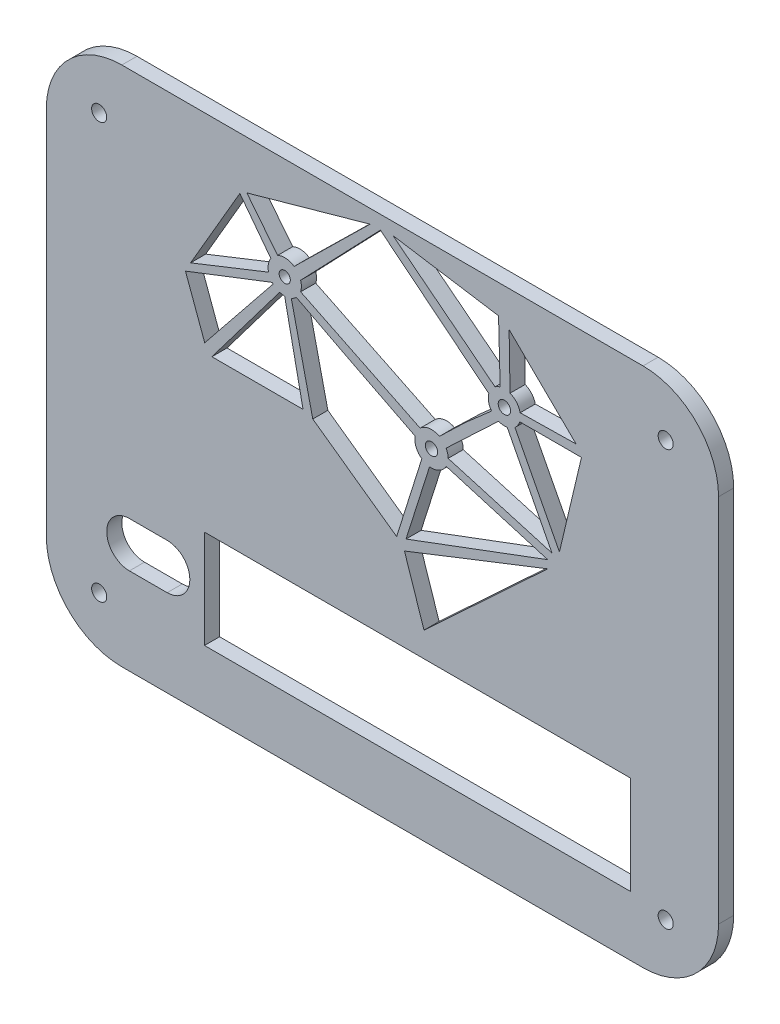
from build123d import *

# Parameters (mm, degrees)
SKETCH_1_R          = 1
EXTRUDE_1_DEPTH     = 2
CUT_EXTRUDE_1_REACH = 114.632
CUT_EXTRUDE_2_REACH = 114.632
SKETCH_3_W          = 56.426209876
SKETCH_3_H          = 13
CUT_EXTRUDE_3_REACH = 114.632
SKETCH_4_R          = 0.740461
SKETCH_4_R_2        = 0.820057981
SKETCH_4_R_3        = 0.813320815


with BuildPart() as part:
    # 草图1 → 凸台-拉伸1 (new body)
    with BuildSketch(Plane.XY):
        with BuildLine():
            ThreePointArc((10, 0), (2.928932188, -2.928932188), (0, -10))
            Line((0, -10), (0, -59))
            ThreePointArc((0, -59), (2.928932188, -66.071067812), (10, -69))
            Line((10, -69), (79, -69))
            ThreePointArc((79, -69), (86.071067812, -66.071067812), (89, -59))
            Line((89, -59), (89, -10))
            ThreePointArc((89, -10), (86.071067812, -2.928932188), (79, 0))
            Line((79, 0), (10, 0))
        make_face()
        with Locations((7, -7)):
            Circle(SKETCH_1_R, mode=Mode.SUBTRACT)
        with Locations((82, -7)):
            Circle(SKETCH_1_R, mode=Mode.SUBTRACT)
        with Locations((7, -62)):
            Circle(SKETCH_1_R, mode=Mode.SUBTRACT)
        with Locations((82, -62)):
            Circle(SKETCH_1_R, mode=Mode.SUBTRACT)
    extrude(amount=-EXTRUDE_1_DEPTH)

    # 草图2 → 切除-拉伸1 (cut, up to next)
    with BuildSketch(Plane.XY, mode=Mode.PRIVATE) as cut_extrude_1_sk1:
        with BuildLine():
            Line((11, -51.5), (16, -51.5))
            ThreePointArc((16, -51.5), (19, -54.5), (16, -57.5))
            Line((16, -57.5), (11, -57.5))
            ThreePointArc((11, -57.5), (8, -54.5), (11, -51.5))
        make_face()
    cut_extrude_1_tool1 = extrude(cut_extrude_1_sk1.sketch, amount=-CUT_EXTRUDE_1_REACH, mode=Mode.PRIVATE) & part.part
    add(cut_extrude_1_tool1.solids().sort_by_distance((13.5, -54.5, 0))[0], mode=Mode.SUBTRACT)

    # 草图3 → 切除-拉伸2 (cut, up to next)
    with BuildSketch(Plane.XY, mode=Mode.PRIVATE) as cut_extrude_2_sk1:
        with Locations((49.151392617, -54.584348468)):
            Rectangle(SKETCH_3_W, SKETCH_3_H)
    cut_extrude_2_tool1 = extrude(cut_extrude_2_sk1.sketch, amount=-CUT_EXTRUDE_2_REACH, mode=Mode.PRIVATE) & part.part
    add(cut_extrude_2_tool1.solids().sort_by_distance((49.151393, -54.584348, 0))[0], mode=Mode.SUBTRACT)

    # 草图4 → 切除-拉伸3 (cut, up to next)
    with BuildSketch(Plane.XY, mode=Mode.PRIVATE) as cut_extrude_3_sk1:
        with BuildLine():
            Line((29.71966231, -12.305090175), (25.624356849, -6.911105654))
            Line((25.624356849, -6.911105654), (19.101020316, -18.131976546))
            Line((19.101020316, -18.131976546), (29.427775095, -14.04090443))
            ThreePointArc((29.427775095, -14.04090443), (29.392941994, -13.142598653), (29.71966231, -12.305090175))
        make_face()
    cut_extrude_3_tool1 = extrude(cut_extrude_3_sk1.sketch, amount=-CUT_EXTRUDE_3_REACH, mode=Mode.PRIVATE) & part.part
    # 草图4 → 切除-拉伸3 (cut, up to next)
    with BuildSketch(Plane.XY, mode=Mode.PRIVATE) as cut_extrude_3_sk2:
        with BuildLine():
            Line((26.551833571, -6.38746953), (30.617859486, -11.518503533))
            ThreePointArc((30.617859486, -11.518503533), (31.736947981, -11.310402053), (32.810649266, -11.688331722))
            Line((32.810649266, -11.688331722), (42.857597029, -1.819271366))
            Line((42.857597029, -1.819271366), (26.551833571, -6.38746953))
        make_face()
    cut_extrude_3_tool2 = extrude(cut_extrude_3_sk2.sketch, amount=-CUT_EXTRUDE_3_REACH, mode=Mode.PRIVATE) & part.part
    # 草图4 → 切除-拉伸3 (cut, up to next)
    with BuildSketch(Plane.XY, mode=Mode.PRIVATE) as cut_extrude_3_sk3:
        with BuildLine():
            ThreePointArc((30.032334908, -15.090731341), (29.972405764, -15.030340271), (29.914851736, -14.967681531))
            Line((29.914851736, -14.967681531), (18.421083699, -19.418282761))
            Line((18.421083699, -19.418282761), (20.971275942, -26.365204728))
            Line((20.971275942, -26.365204728), (30.032334908, -15.090731341))
        make_face()
    cut_extrude_3_tool3 = extrude(cut_extrude_3_sk3.sketch, amount=-CUT_EXTRUDE_3_REACH, mode=Mode.PRIVATE) & part.part
    # 草图4 → 切除-拉伸3 (cut, up to next)
    with BuildSketch(Plane.XY, mode=Mode.PRIVATE) as cut_extrude_3_sk4:
        with BuildLine():
            Line((44.225353899, -1.819271366), (33.668211048, -12.842696697))
            ThreePointArc((33.668211048, -12.842696697), (33.771051205, -13.50813486), (33.668211048, -14.173573023))
            Line((33.668211048, -14.173573023), (49.492109237, -21.888754028))
            ThreePointArc((49.492109237, -21.888754028), (50.711573343, -21.316782641), (52.036115922, -21.561386254))
            Line((52.036115922, -21.561386254), (55.490802813, -18.236876623))
            Line((55.490802813, -18.236876623), (58.941354458, -15.204854904))
            ThreePointArc((58.941354458, -15.204854904), (58.555360551, -14.33538652), (58.58699022, -13.384615186))
            Line((58.58699022, -13.384615186), (44.225353899, -1.819271366))
        make_face()
    cut_extrude_3_tool4 = extrude(cut_extrude_3_sk4.sketch, amount=-CUT_EXTRUDE_3_REACH, mode=Mode.PRIVATE) & part.part
    # 草图4 → 切除-拉伸3 (cut, up to next)
    with BuildSketch(Plane.XY, mode=Mode.PRIVATE) as cut_extrude_3_sk5:
        with BuildLine():
            ThreePointArc((31.554094643, -15.712412849), (31.220078502, -15.685020065), (30.894075467, -15.607307982))
            Line((30.894075467, -15.607307982), (21.91981842, -27.487784108))
            Line((21.91981842, -27.487784108), (33.987562974, -27.487784108))
            Line((33.987562974, -27.487784108), (31.554094643, -15.712412849))
        make_face()
    cut_extrude_3_tool5 = extrude(cut_extrude_3_sk5.sketch, amount=-CUT_EXTRUDE_3_REACH, mode=Mode.PRIVATE) & part.part
    # 草图4 → 切除-拉伸3 (cut, up to next)
    with BuildSketch(Plane.XY, mode=Mode.PRIVATE) as cut_extrude_3_sk6:
        with BuildLine():
            Line((45.888987928, -1.608866352), (59.403976502, -12.200184937))
            ThreePointArc((59.403976502, -12.200184937), (59.729360819, -12.008222916), (60.083573274, -11.876853558))
            Line((60.083573274, -11.876853558), (59.870610643, -3.82441582))
            Line((59.870610643, -3.82441582), (45.888987928, -1.608866352))
        make_face()
    cut_extrude_3_tool6 = extrude(cut_extrude_3_sk6.sketch, amount=-CUT_EXTRUDE_3_REACH, mode=Mode.PRIVATE) & part.part
    # 草图4 → 切除-拉伸3 (cut, up to next)
    with BuildSketch(Plane.XY, mode=Mode.PRIVATE) as cut_extrude_3_sk7:
        with BuildLine():
            Line((39.670415507, -18.489723809), (33.101139016, -15.090731341))
            ThreePointArc((33.101139016, -15.090731341), (32.788510306, -15.342874945), (32.435320163, -15.534107344))
            Line((32.435320163, -15.534107344), (35.273577474, -27.953433219))
            Line((35.273577474, -27.953433219), (46.381058376, -35.875964466))
            Line((46.381058376, -35.875964466), (49.71272558, -25.296027344))
            ThreePointArc((49.71272558, -25.296027344), (48.953979817, -24.33842803), (48.821972428, -23.123822897))
            Line((48.821972428, -23.123822897), (39.670415507, -18.489723809))
        make_face()
    cut_extrude_3_tool7 = extrude(cut_extrude_3_sk7.sketch, amount=-CUT_EXTRUDE_3_REACH, mode=Mode.PRIVATE) & part.part
    # 草图4 → 切除-拉伸3 (cut, up to next)
    with BuildSketch(Plane.XY, mode=Mode.PRIVATE) as cut_extrude_3_sk8:
        with BuildLine():
            ThreePointArc((61.014395674, -16.023297199), (60.434752375, -16.045705576), (59.870610643, -15.91067745))
            Line((59.870610643, -15.91067745), (52.932925458, -22.457448275))
            ThreePointArc((52.932925458, -22.457448275), (53.129531926, -22.96355083), (53.196421001, -23.50236411))
            Line((53.196421001, -23.50236411), (66.944484677, -27.487784108))
            Line((66.944484677, -27.487784108), (61.014395674, -16.023297199))
        make_face()
    cut_extrude_3_tool8 = extrude(cut_extrude_3_sk8.sketch, amount=-CUT_EXTRUDE_3_REACH, mode=Mode.PRIVATE) & part.part
    # 草图4 → 切除-拉伸3 (cut, up to next)
    with BuildSketch(Plane.XY, mode=Mode.PRIVATE) as cut_extrude_3_sk9:
        with BuildLine():
            Line((61.270019501, -4.698540732), (61.390679607, -11.937596605))
            ThreePointArc((61.390679607, -11.937596605), (62.262550714, -12.549874129), (62.728146423, -13.50813486))
            Line((62.728146423, -13.50813486), (70.138763344, -13.384615186))
            Line((70.138763344, -13.384615186), (61.270019501, -4.698540732))
        make_face()
    cut_extrude_3_tool9 = extrude(cut_extrude_3_sk9.sketch, amount=-CUT_EXTRUDE_3_REACH, mode=Mode.PRIVATE) & part.part
    # 草图4 → 切除-拉伸3 (cut, up to next)
    with BuildSketch(Plane.XY, mode=Mode.PRIVATE) as cut_extrude_3_sk10:
        with BuildLine():
            ThreePointArc((62.671923931, -14.567955784), (62.422172629, -15.094839311), (62.038733508, -15.534107344))
            Line((62.038733508, -15.534107344), (67.93091315, -26.870821866))
            Line((67.93091315, -26.870821866), (70.848713756, -14.567955784))
            Line((70.848713756, -14.567955784), (62.671923931, -14.567955784))
        make_face()
    cut_extrude_3_tool10 = extrude(cut_extrude_3_sk10.sketch, amount=-CUT_EXTRUDE_3_REACH, mode=Mode.PRIVATE) & part.part
    # 草图4 → 切除-拉伸3 (cut, up to next)
    with BuildSketch(Plane.XY, mode=Mode.PRIVATE) as cut_extrude_3_sk11:
        with BuildLine():
            ThreePointArc((52.932925458, -24.547279946), (52.0105537, -25.456866509), (50.736467157, -25.691005052))
            Line((50.736467157, -25.691005052), (47.619493897, -35.541205516))
            Line((47.619493897, -35.541205516), (66.381949553, -28.52489892))
            Line((66.381949553, -28.52489892), (52.932925458, -24.547279946))
        make_face()
    cut_extrude_3_tool11 = extrude(cut_extrude_3_sk11.sketch, amount=-CUT_EXTRUDE_3_REACH, mode=Mode.PRIVATE) & part.part
    # 草图4 → 切除-拉伸3 (cut, up to next)
    with BuildSketch(Plane.XY, mode=Mode.PRIVATE) as cut_extrude_3_sk12:
        Polygon((66.381949553, -29.57390315), (47.414429955, -37.012816769), (50.002721586, -44.796327362), align=None)
    cut_extrude_3_tool12 = extrude(cut_extrude_3_sk12.sketch, amount=-CUT_EXTRUDE_3_REACH, mode=Mode.PRIVATE) & part.part
    # 草图4 → 切除-拉伸3 (cut, up to next)
    with BuildSketch(Plane.XY, mode=Mode.PRIVATE) as cut_extrude_3_sk13:
        with Locations((31.566736962, -13.50813486)):
            Circle(SKETCH_4_R)
    cut_extrude_3_tool13 = extrude(cut_extrude_3_sk13.sketch, amount=-CUT_EXTRUDE_3_REACH, mode=Mode.PRIVATE) & part.part
    # 草图4 → 切除-拉伸3 (cut, up to next)
    with BuildSketch(Plane.XY, mode=Mode.PRIVATE) as cut_extrude_3_sk14:
        with Locations((60.643174965, -13.928930845)):
            Circle(SKETCH_4_R_2)
    cut_extrude_3_tool14 = extrude(cut_extrude_3_sk14.sketch, amount=-CUT_EXTRUDE_3_REACH, mode=Mode.PRIVATE) & part.part
    # 草图4 → 切除-拉伸3 (cut, up to next)
    with BuildSketch(Plane.XY, mode=Mode.PRIVATE) as cut_extrude_3_sk15:
        with Locations((50.992818256, -23.50236411)):
            Circle(SKETCH_4_R_3)
    cut_extrude_3_tool15 = extrude(cut_extrude_3_sk15.sketch, amount=-CUT_EXTRUDE_3_REACH, mode=Mode.PRIVATE) & part.part
    add(cut_extrude_3_tool1.solids().sort_by_distance((25.011842, -12.854316, 0))[0], mode=Mode.SUBTRACT)
    add(cut_extrude_3_tool2.solids().sort_by_distance((33.74434, -6.871453, 0))[0], mode=Mode.SUBTRACT)
    add(cut_extrude_3_tool3.solids().sort_by_distance((23.203214, -20.212828, 0))[0], mode=Mode.SUBTRACT)
    add(cut_extrude_3_tool4.solids().sort_by_distance((46.461025, -12.730661, 0))[0], mode=Mode.SUBTRACT)
    add(cut_extrude_3_tool5.solids().sort_by_distance((29.093471, -23.333256, 0))[0], mode=Mode.SUBTRACT)
    add(cut_extrude_3_tool6.solids().sort_by_distance((55.26529, -6.029531, 0))[0], mode=Mode.SUBTRACT)
    add(cut_extrude_3_tool7.solids().sort_by_distance((41.234753, -25.276038, 0))[0], mode=Mode.SUBTRACT)
    add(cut_extrude_3_tool8.solids().sort_by_distance((59.945552, -22.002112, 0))[0], mode=Mode.SUBTRACT)
    add(cut_extrude_3_tool9.solids().sort_by_distance((64.36509, -10.447465, 0))[0], mode=Mode.SUBTRACT)
    add(cut_extrude_3_tool10.solids().sort_by_distance((66.82224, -18.709407, 0))[0], mode=Mode.SUBTRACT)
    add(cut_extrude_3_tool11.solids().sort_by_distance((55.1633, -29.475435, 0))[0], mode=Mode.SUBTRACT)
    add(cut_extrude_3_tool12.solids().sort_by_distance((54.5997, -37.127682, 0))[0], mode=Mode.SUBTRACT)
    add(cut_extrude_3_tool13.solids().sort_by_distance((31.566737, -13.508135, 0))[0], mode=Mode.SUBTRACT)
    add(cut_extrude_3_tool14.solids().sort_by_distance((60.643175, -13.928931, 0))[0], mode=Mode.SUBTRACT)
    add(cut_extrude_3_tool15.solids().sort_by_distance((50.992818, -23.502364, 0))[0], mode=Mode.SUBTRACT)


solid = part.part
